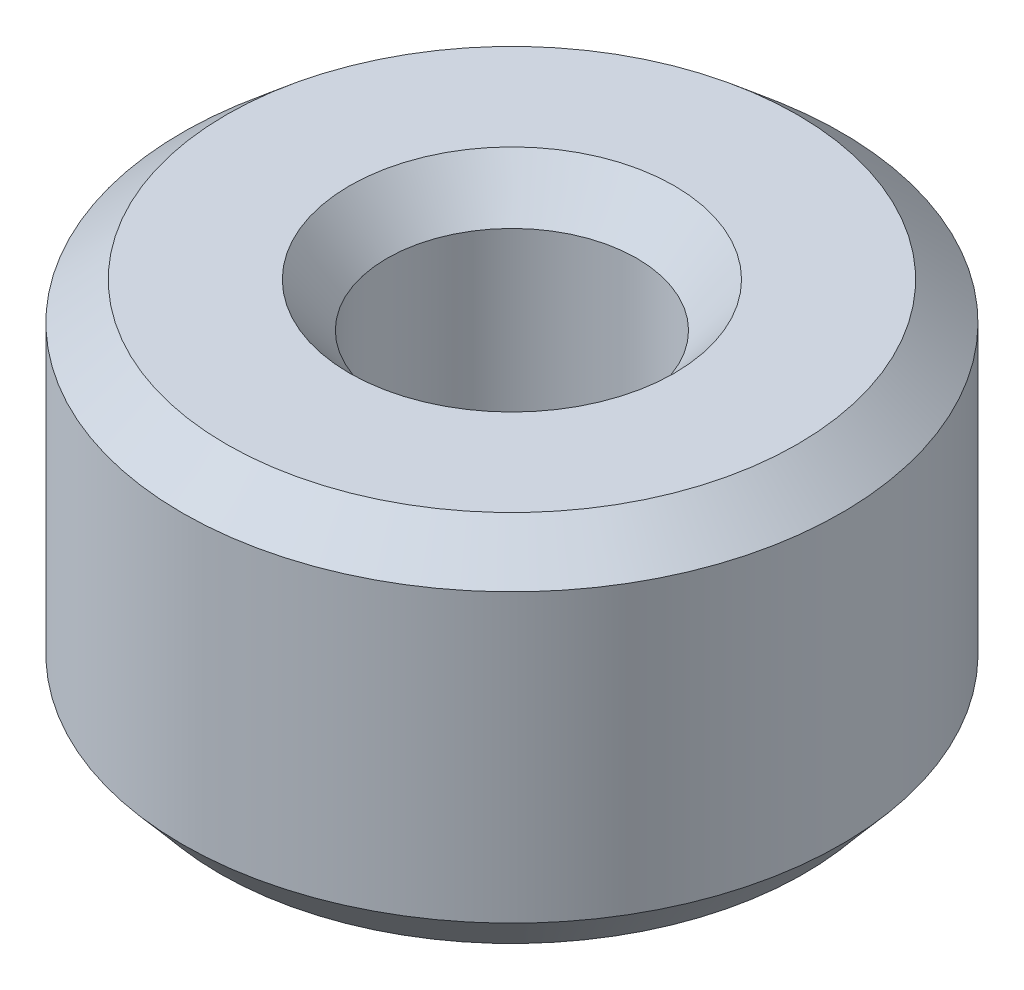
from build123d import *
from OCP.BRepFilletAPI import BRepFilletAPI_MakeChamfer

# Parameters (mm, degrees)
SKETCH1_R           = 10
BOSS_EXTRUDE1_DEPTH = 11.182777197
SKETCH2_R           = 3.789950324
CUT_EXTRUDE1_DEPTH  = 19.029268034
CHAMFER1_SIZE       = 1.136925523
CHAMFER1_SIZE2      = 1.337976375


with BuildPart() as part:
    # Sketch1 → Boss-Extrude1 (new body)
    with BuildSketch(Plane(origin=(0, 0, 0), x_dir=(1, 0, 0), z_dir=(0, 1, 0))):
        Circle(SKETCH1_R)
    extrude(amount=BOSS_EXTRUDE1_DEPTH)

    # Sketch2 → Cut-Extrude1 (cut, through all)
    with BuildSketch(Plane(origin=(0, 0, 0), x_dir=(1, 0, 0), z_dir=(0, 1, 0))):
        Circle(SKETCH2_R)
    extrude(amount=CUT_EXTRUDE1_DEPTH, mode=Mode.SUBTRACT)

    # Chamfer1: one chamfer whose edges measure the first distance from different faces: ONE call of the kernel's chamfer builder (chamfer() names one face for all edges)
    chamfer1_edges_1 = [part.edges().sort_by_distance(p)[0] for p in [
        (-3.789950324, 11.182777197, 0),
    ]]
    chamfer1_side_1 = [part.faces().sort_by_distance(p)[0] for p in [
        (-9.717157288, 11.182777197, 0),
    ]]
    chamfer1_edges_2 = [part.edges().sort_by_distance(p)[0] for p in [
        (-3.789950324, 0, 0),
    ]]
    chamfer1_side_2 = [part.faces().sort_by_distance(p)[0] for p in [
        (-3.789950324, 5.591388598, 0),
    ]]
    chamfer1_edges_3 = [part.edges().sort_by_distance(p)[0] for p in [
        (-10, 0, 0),
    ]]
    chamfer1_side_3 = [part.faces().sort_by_distance(p)[0] for p in [
        (-9.717157288, 0, 0),
    ]]
    chamfer1_edges_4 = [part.edges().sort_by_distance(p)[0] for p in [
        (-10, 11.182777197, 0),
    ]]
    chamfer1_side_4 = [part.faces().sort_by_distance(p)[0] for p in [
        (-10, 5.591388598, 0),
    ]]
    chamfer1 = BRepFilletAPI_MakeChamfer(part.part.solid().wrapped)
    for e in chamfer1_edges_1:
        chamfer1.Add(CHAMFER1_SIZE, CHAMFER1_SIZE2, e.wrapped, chamfer1_side_1[0].wrapped)  # the first distance lies on this face
    for e in chamfer1_edges_2:
        chamfer1.Add(CHAMFER1_SIZE, CHAMFER1_SIZE2, e.wrapped, chamfer1_side_2[0].wrapped)  # the first distance lies on this face
    for e in chamfer1_edges_3:
        chamfer1.Add(CHAMFER1_SIZE, CHAMFER1_SIZE2, e.wrapped, chamfer1_side_3[0].wrapped)  # the first distance lies on this face
    for e in chamfer1_edges_4:
        chamfer1.Add(CHAMFER1_SIZE, CHAMFER1_SIZE2, e.wrapped, chamfer1_side_4[0].wrapped)  # the first distance lies on this face
    add(Compound.cast(chamfer1.Shape()), mode=Mode.REPLACE)


solid = part.part
